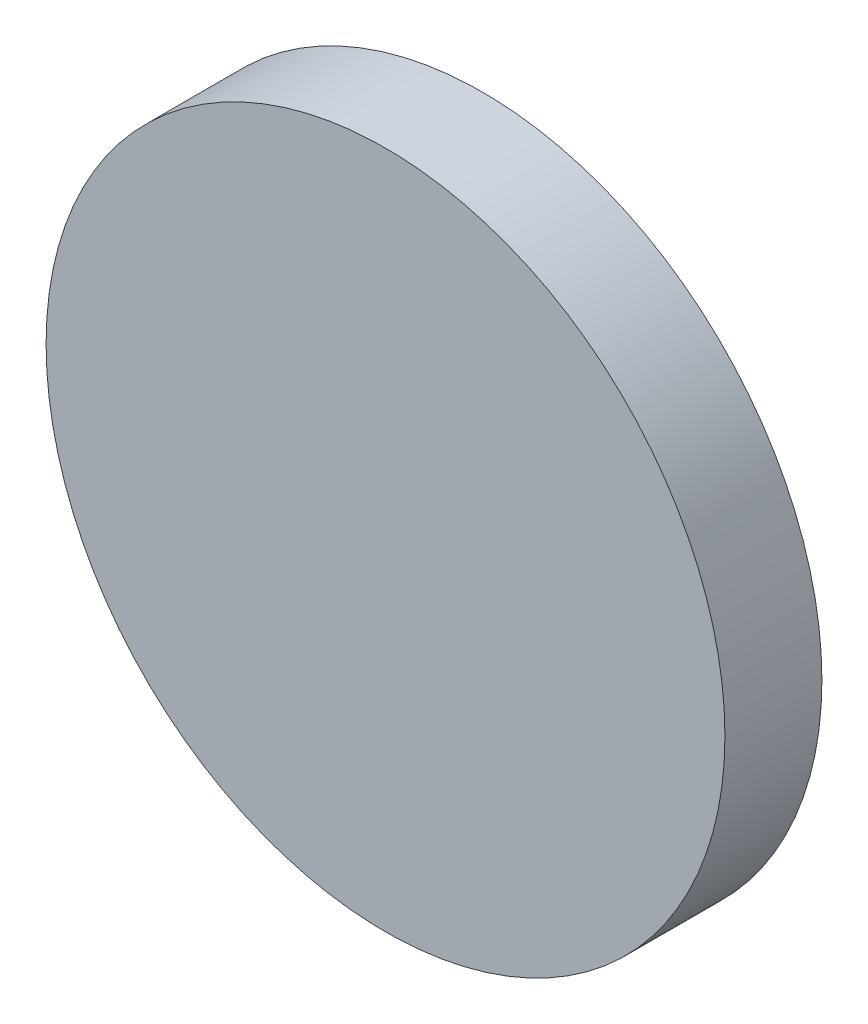
from build123d import *

# Parameters (mm, degrees)
SKETCH_1_R      = 14
EXTRUDE_1_DEPTH = 4


with BuildPart() as part:
    # 草圖1 → 填料-伸長1 (new body)
    with BuildSketch(Plane.XY):
        Circle(SKETCH_1_R)
    extrude(amount=EXTRUDE_1_DEPTH)


solid = part.part
